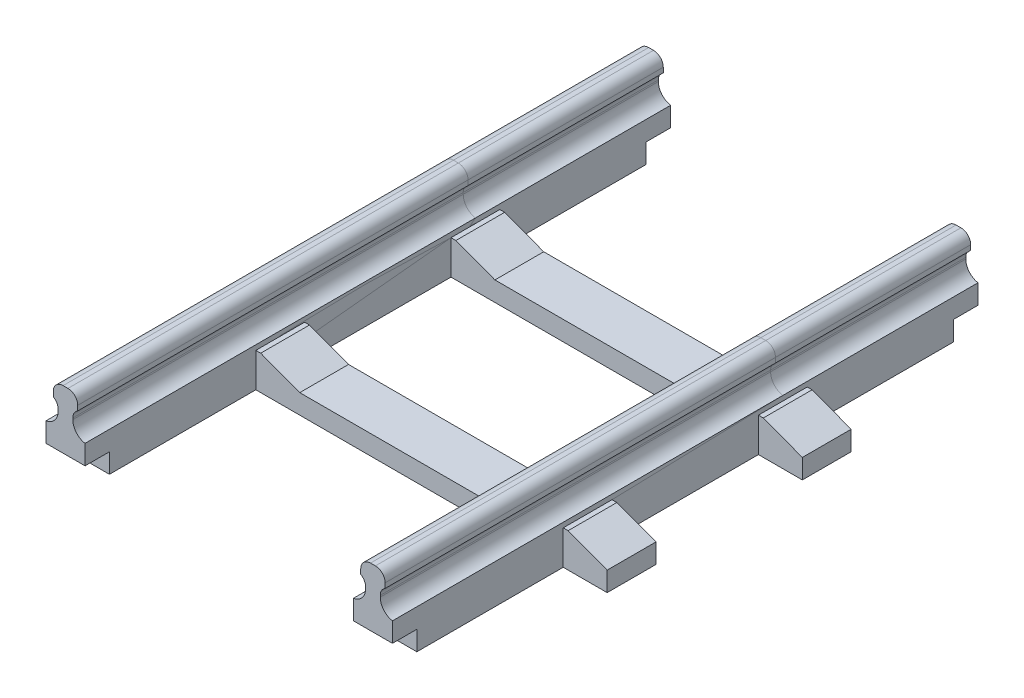
from build123d import *

# Parameters (mm, degrees)
SKETCH_1_W             = 4
SKETCH_1_H             = 17.5
SKETCH_1_H_2           = 5
EXTRUDE_1_DEPTH        = 4
SKETCH_1_7_W           = 44.5
SKETCH_1_7_H           = 5
EXTRUDE_2_DEPTH        = 3.5
SKETCH_2_W             = 18.5
SKETCH_2_H             = 1.5
CUT_EXTRUDE_1_DEPTH    = 32.89533665
SKETCH_2_3_W           = 2.5
SKETCH_2_3_H           = 1.5
EXTRUDE_4_DEPTH        = 22.5
FILLET_1_R             = 1
FILLET_2_R             = 1.5
FILLET_3_R             = 1
SKETCH_5_W             = 2.5
SKETCH_5_H             = 2
CUT_EXTRUDE_2_DEPTH    = 43.315038698
SKETCH_10_R            = 0.4
CUT_EXTRUDE_3_DEPTH    = 2
PATTERN_LINEAR_2_COUNT = 2
PATTERN_LINEAR_2_PITCH = 20


with BuildPart() as part:
    # 草图1 → 凸台-拉伸1 (new body)
    with BuildSketch(Plane(origin=(0, 0, 0), x_dir=(1, 0, 0), z_dir=(0, 1, 0))):
        with Locations((-15.75, -2.5)):
            Rectangle(SKETCH_1_W, SKETCH_1_H)
        with Locations((15.75, -2.5)):
            Rectangle(SKETCH_1_W, SKETCH_1_H)
        with Locations((15.75, 8.75)):
            Rectangle(SKETCH_1_W, SKETCH_1_H_2)
        with Locations((-15.75, 8.75)):
            Rectangle(SKETCH_1_W, SKETCH_1_H_2)
    extrude(amount=EXTRUDE_1_DEPTH)

    # 草图1<7> → 凸台-拉伸2 (add)
    with BuildSketch(Plane(origin=(0, 0, 0), x_dir=(1, 0, 0), z_dir=(0, 1, 0))):
        with Locations((0, 8.75)):
            Rectangle(SKETCH_1_7_W, SKETCH_1_7_H)
    extrude(amount=EXTRUDE_2_DEPTH)

    # 草图2 → 切除-拉伸1 (cut, through all)
    with BuildSketch(Plane(origin=(0, 0, -11.25), x_dir=(-1, 0, 0), z_dir=(0, 0, -1))):
        with Locations((0, 2.75)):
            Rectangle(SKETCH_2_W, SKETCH_2_H)
        Polygon((13.25, 3.5), (9.25, 3.5), (9.25, 2), align=None)
        Polygon((-9.25, 3.5), (-13.25, 3.5), (-9.25, 2), align=None)
        Polygon((-22.25, 3.5), (-22.25, 2), (-18.25, 3.5), align=None)
        Polygon((22.25, 3.5), (18.25, 3.5), (22.25, 2), align=None)
    extrude(amount=-CUT_EXTRUDE_1_DEPTH, mode=Mode.SUBTRACT)

    # 草图2<3> → 凸台-拉伸4 (add, through all)
    with BuildSketch(Plane(origin=(0, 0, -11.25), x_dir=(-1, 0, 0), z_dir=(0, 0, -1))):
        with Locations((-15.75, 7.25)):
            Rectangle(SKETCH_2_3_W, SKETCH_2_3_H)
        Polygon((-15, 6.5), (-16.5, 6.5), (-16.5, 4), (-15.75, 4), (-15, 4), align=None)
        with Locations((15.75, 7.25)):
            Rectangle(SKETCH_2_3_W, SKETCH_2_3_H)
        Polygon((16.5, 6.5), (15, 6.5), (15, 4), (15.75, 4), (16.5, 4), align=None)
    extrude(amount=-EXTRUDE_4_DEPTH)

    # 圆角1
    # the kernel refuses this fillet: 1 mm, written as the material it adds along each edge
    with BuildSketch(Plane(origin=(-16.5, 6.5, -11.25), x_dir=(0, -1, 0), z_dir=(0, 0, 1))) as fillet_1_piece_1:
        with BuildLine():
            CenterArc((0.866025404, -1), FILLET_1_R, 90, 60)
            Line((0, -0.5), (-0.017320508, -0.49))
            ThreePointArc((-0.017320508, -0.49), (-0.02, -0.25), (-0.02, 0))
            Line((-0.02, 0), (0, 0.02))
            Line((0, 0.02), (0.866025404, 0.02))
            Line((0.866025404, 0.02), (0.866025404, 0))
        make_face()
    extrude(amount=22.5)
    with BuildSketch(Plane(origin=(-15, 6.5, -11.25), x_dir=(0, -1, 0), z_dir=(0, 0, 1)), Plane(origin=(16.5, 6.5, -11.25), x_dir=(0, -1, 0), z_dir=(0, 0, 1))) as fillet_1_piece_2:
        with BuildLine():
            CenterArc((0.866025404, 1), FILLET_1_R, 210, 60)
            Line((0, 0.5), (-0.017320508, 0.49))
            ThreePointArc((-0.017320508, 0.49), (-0.02, 0.25), (-0.02, 0))
            Line((-0.02, 0), (0, -0.02))
            Line((0, -0.02), (0.866025404, -0.02))
            Line((0.866025404, -0.02), (0.866025404, 0))
        make_face()
    extrude(amount=22.5)
    with BuildSketch(Plane(origin=(15, 6.5, -11.25), x_dir=(-1, 0, 0), z_dir=(0, 0, 1))) as fillet_1_piece_3:
        with BuildLine():
            CenterArc((1, 0.866025404), FILLET_1_R, 180, 60)
            Line((0, 0.866025404), (-0.02, 0.866025404))
            Line((-0.02, 0.866025404), (-0.02, 0))
            Line((-0.02, 0), (0, -0.02))
            ThreePointArc((0, -0.02), (0.25, -0.02), (0.49, -0.017320508))
            Line((0.49, -0.017320508), (0.5, 0))
        make_face()
    extrude(amount=22.5)

    # 圆角2
    # the kernel refuses this fillet: 1.5 mm, written as the material it adds along each edge
    with BuildSketch(Plane(origin=(16.5, 4, -11.25), x_dir=(1, 0, 0), z_dir=(0, 0, 1)), Plane(origin=(-15, 4, -11.25), x_dir=(1, 0, 0), z_dir=(0, 0, 1))) as fillet_2_piece_1:
        with BuildLine():
            CenterArc((1.5, 1.479019946), FILLET_2_R, 180, 80.405931773)
            Line((0, 1.479019946), (-0.03, 1.479019946))
            Line((-0.03, 1.479019946), (-0.03, 0))
            Line((-0.03, 0), (0, -0.03))
            ThreePointArc((0, -0.03), (0.625, -0.03), (1.245, -0.029580399))
            Line((1.245, -0.029580399), (1.25, 0))
        make_face()
    extrude(amount=22.5)
    with BuildSketch(Plane(origin=(15, 4, -11.25), x_dir=(0, 1, 0), z_dir=(0, 0, 1)), Plane(origin=(-16.5, 4, -11.25), x_dir=(0, 1, 0), z_dir=(0, 0, 1))) as fillet_2_piece_2:
        with BuildLine():
            CenterArc((1.479019946, 1.5), FILLET_2_R, 189.594068227, 80.405931773)
            Line((0, 1.25), (-0.029580399, 1.245))
            ThreePointArc((-0.029580399, 1.245), (-0.03, 0.625), (-0.03, 0))
            Line((-0.03, 0), (0, -0.03))
            Line((0, -0.03), (1.479019946, -0.03))
            Line((1.479019946, -0.03), (1.479019946, 0))
        make_face()
    extrude(amount=22.5)

    # 圆角3
    fillet_3_edges = [part.edges().sort_by_distance(p)[0] for p in [
        (14.5, 8, 0),
        (17, 8, 0),
        (-17, 8, 0),
        (-14.5, 8, 0),
    ]]
    fillet(fillet_3_edges, radius=FILLET_3_R)

    # 草图5 → 切除-拉伸2 (cut, through all)
    with BuildSketch(Plane(origin=(17.75, 0, 0), x_dir=(0, 0, -1), z_dir=(1, 0, 0))):
        with Locations((-10, 1)):
            Rectangle(SKETCH_5_W, SKETCH_5_H)
    extrude(amount=-CUT_EXTRUDE_2_DEPTH, mode=Mode.SUBTRACT)

    # 草图10 → 切除-拉伸3 (cut)
    with BuildSketch(Plane.XZ.offset(-2)):
        with Locations(Location((15.75, 10, 0), (0, 0, 270))):
            Circle(SKETCH_10_R)
        with Locations(Location((-15.75, 10, 0), (0, 0, 270))):
            Circle(SKETCH_10_R)
    extrude(amount=-CUT_EXTRUDE_3_DEPTH, mode=Mode.SUBTRACT)

    # 镜向1: part across plane


with BuildPart() as part_1:
    add(part.part)
    add(part.part.mirror(Plane(origin=(0, 0, -8.75), x_dir=(1, 0, 0), z_dir=(0, 0, -1))))


with BuildPart() as pattern_linear_2_1:
    # 阵列(线性)2: pattern copy
    add(part_1.part.moved(Location(Vector(0, 0, -1) * (1 * PATTERN_LINEAR_2_PITCH))))


solid = Compound([part_1.part, pattern_linear_2_1.part])
